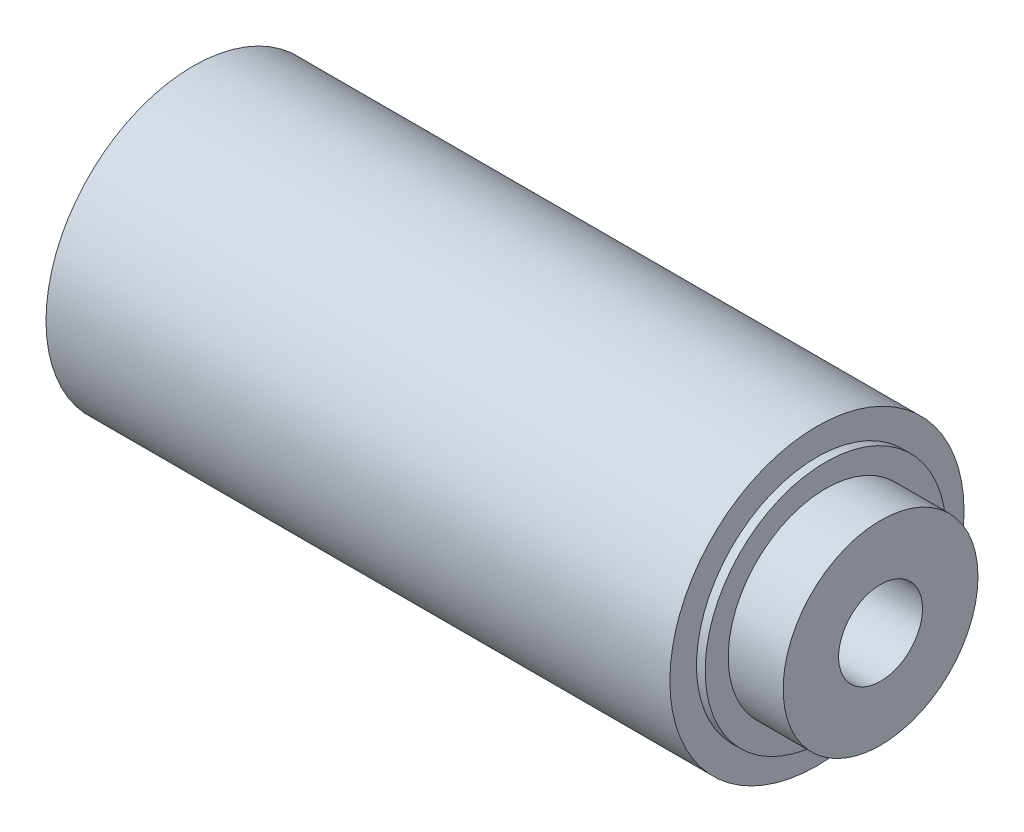
from build123d import *

# Parameters (mm, degrees)
SKETCH1_R           = 54.345
BOSS_EXTRUDE1_DEPTH = 254
CUT_EXTRUDE1_DEPTH  = 100
SKETCH3_R           = 7
CUT_EXTRUDE2_DEPTH  = 139
SKETCH3_4_R         = 15.5
SKETCH3_4_R_2       = 7
CUT_EXTRUDE3_DEPTH  = 65
CUT_EXTRUDE4_START  = -23.5
SKETCH3_6_R         = 54.345
SKETCH3_6_R_2       = 44.5
CUT_EXTRUDE4_DEPTH  = 23.5
CUT_EXTRUDE5_START  = -20.3
SKETCH3_7_R         = 44.5
SKETCH3_7_R_2       = 36
CUT_EXTRUDE5_DEPTH  = 20.3
CHAMFER1_SIZE       = 10


with BuildPart() as part:
    # Sketch1 → Boss-Extrude1 (new body)
    with BuildSketch(Plane(origin=(0, 0, 0), x_dir=(0, 0, -1), z_dir=(1, 0, 0))):
        Circle(SKETCH1_R)
    extrude(amount=BOSS_EXTRUDE1_DEPTH)

    # Sketch2 → Cut-Extrude1 (cut)
    with BuildSketch(Plane(origin=(0, 0, 0), x_dir=(0, 0, -1), z_dir=(1, 0, 0))):
        with BuildLine():
            Line((20.694, 28.194), (-20.694, 28.194))
            ThreePointArc((-20.694, 28.194), (-22.890699141, 22.890699141), (-28.194, 20.694))
            Line((-28.194, 20.694), (-28.194, -20.694))
            ThreePointArc((-28.194, -20.694), (-22.890699141, -22.890699141), (-20.694, -28.194))
            Line((-20.694, -28.194), (20.694, -28.194))
            ThreePointArc((20.694, -28.194), (22.890699141, -22.890699141), (28.194, -20.694))
            Line((28.194, -20.694), (28.194, 20.694))
            ThreePointArc((28.194, 20.694), (22.890699141, 22.890699141), (20.694, 28.194))
        make_face()
    extrude(amount=CUT_EXTRUDE1_DEPTH, mode=Mode.SUBTRACT)

    # Sketch3 → Cut-Extrude2 (cut)
    with BuildSketch(Plane(origin=(254, 0, 0), x_dir=(0, 0, -1), z_dir=(1, 0, 0))):
        Circle(SKETCH3_R)
    extrude(amount=-CUT_EXTRUDE2_DEPTH, mode=Mode.SUBTRACT)

    # Sketch3<4> → Cut-Extrude3 (cut)
    with BuildSketch(Plane(origin=(254, 0, 0), x_dir=(0, 0, -1), z_dir=(1, 0, 0))):
        Circle(SKETCH3_4_R)
        Circle(SKETCH3_4_R_2, mode=Mode.SUBTRACT)
    extrude(amount=-CUT_EXTRUDE3_DEPTH, mode=Mode.SUBTRACT)

    # Sketch3<6> → Cut-Extrude4 (cut)
    with BuildSketch(Plane(origin=(254, 0, 0), x_dir=(0, 0, -1), z_dir=(1, 0, 0)).offset(CUT_EXTRUDE4_START)):
        Circle(SKETCH3_6_R)
        Circle(SKETCH3_6_R_2, mode=Mode.SUBTRACT)
    extrude(amount=CUT_EXTRUDE4_DEPTH, mode=Mode.SUBTRACT)

    # Sketch3<7> → Cut-Extrude5 (cut)
    with BuildSketch(Plane(origin=(254, 0, 0), x_dir=(0, 0, -1), z_dir=(1, 0, 0)).offset(CUT_EXTRUDE5_START)):
        Circle(SKETCH3_7_R)
        Circle(SKETCH3_7_R_2, mode=Mode.SUBTRACT)
    extrude(amount=CUT_EXTRUDE5_DEPTH, mode=Mode.SUBTRACT)

    # Chamfer1
    # the kernel refuses this chamfer: 10 mm, written as the material it adds along each edge
    with BuildSketch(Plane(origin=(189, 0, 0), x_dir=(0, 0, -1), z_dir=(0, -1, 0))) as chamfer1_piece_1_section:
        Polygon((15.5, CHAMFER1_SIZE), (15.5 - CHAMFER1_SIZE, 0), (15.5, 0), align=None)
    chamfer1_piece_1 = revolve(axis=Axis((189, 0, 0), (1, 0, 0)), mode=Mode.PRIVATE)
    chamfer1_piece_1 = chamfer1_piece_1 - Plane(origin=(194.777828899, 0, 0), x_dir=(0, 0, -1), z_dir=(1, 0, 0)) * Cylinder(7, 62, mode=Mode.PRIVATE)
    add(chamfer1_piece_1)


solid = part.part
